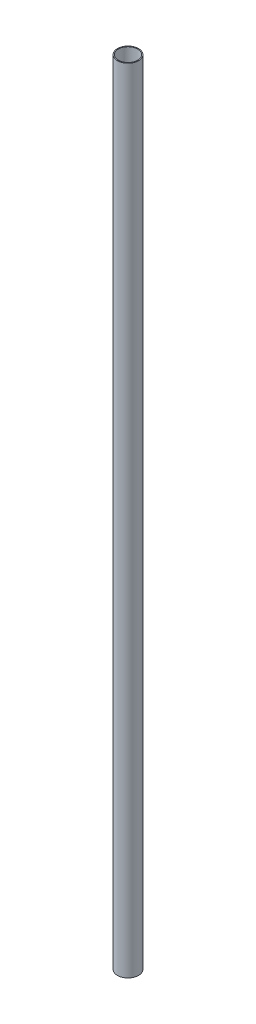
from build123d import *

# Parameters (mm, degrees)
SKETCH_1_R      = 6
SKETCH_1_R_2    = 5.5
EXTRUDE_1_DEPTH = 450


with BuildPart() as part:
    # 草图1 → 凸台-拉伸1 (new body)
    with BuildSketch(Plane(origin=(0, 0, 0), x_dir=(1, 0, 0), z_dir=(0, 1, 0))):
        Circle(SKETCH_1_R)
        Circle(SKETCH_1_R_2, mode=Mode.SUBTRACT)
    extrude(amount=EXTRUDE_1_DEPTH)


solid = part.part
